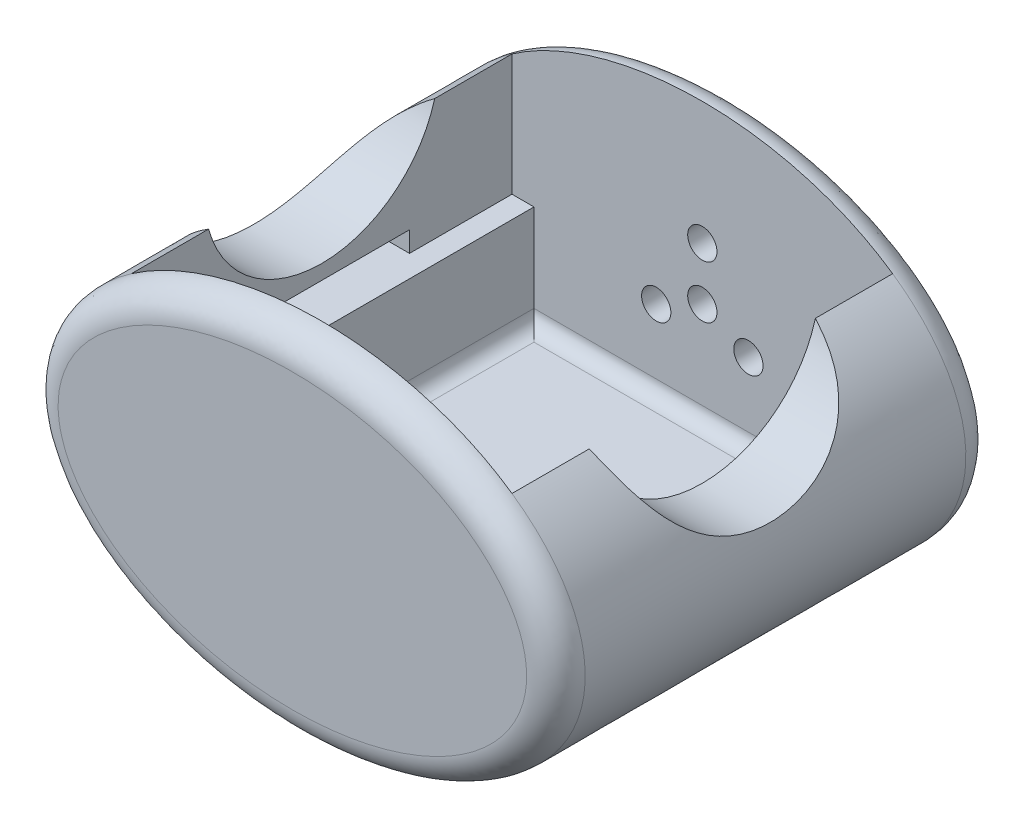
from build123d import *

# Parameters (mm, degrees)
SKETCH1_RX               = 22.86
SKETCH1_RY               = 15.24
BOSS_EXTRUDE4_DEPTH      = 45.72
CUT_EXTRUDE2_START       = -10.16
SKETCH4_W                = 29.21
SKETCH4_H                = 17.78
CUT_EXTRUDE2_DEPTH       = 33.02
CUT_EXTRUDE4_DEPTH       = 33.02
CUT_EXTRUDE4_DEPTH_BACK  = 33.02
SKETCH7_W                = 14.643913221
SKETCH7_H                = 35.56
SKETCH8_R                = 1.27
CUT_EXTRUDE5_DEPTH       = 2.54
FILLET1_R                = 2.54
FILLET2_R                = 2.54
FILLET3_R                = 1.27
CUT_EXTRUDE13_START      = -2.54
SKETCH13_W               = 5.08
SKETCH13_H               = 5.08
CUT_EXTRUDE13_DEPTH      = 49.021314431
CUT_EXTRUDE14_DEPTH      = 52.821602807
CUT_EXTRUDE14_DEPTH_BACK = 52.821602807
SKETCH14_R               = 0.5
CUT_EXTRUDE16_START      = -2.54
SKETCH12_W               = 33.02
SKETCH12_H               = 19.05
CUT_EXTRUDE16_DEPTH      = 33.02
SKETCH17_W               = 15.24
SKETCH17_H               = 1.778
CUT_EXTRUDE17_DEPTH      = 1.778
SKETCH18_W               = 15.24
SKETCH18_H               = 1.778
CUT_EXTRUDE18_DEPTH      = 1.778
CUT_EXTRUDE19_DEPTH      = 47.972834865
CUT_EXTRUDE19_DEPTH_BACK = 47.972834865
SKETCH19_R               = 10.16


with BuildPart() as part:
    # Sketch1 → Boss-Extrude4 (new body)
    with BuildSketch(Plane.XY):
        with Locations(Location((0, 0), (0, 0, 180))):
            Ellipse(SKETCH1_RX, SKETCH1_RY)
    extrude(amount=BOSS_EXTRUDE4_DEPTH)

    # Sketch4 → Cut-Extrude2 (cut)
    with BuildSketch(Plane.XY.offset(45.72).offset(CUT_EXTRUDE2_START)):
        Rectangle(SKETCH4_W, SKETCH4_H)
    extrude(amount=-CUT_EXTRUDE2_DEPTH, mode=Mode.SUBTRACT)

    # Sketch7 → Cut-Extrude4 (cut, two sides: drawn at the far end of the back side and taken through both)
    with BuildSketch(Plane(origin=(0, 0, 0), x_dir=(0, 0, -1), z_dir=(1, 0, 0)).offset(-CUT_EXTRUDE4_DEPTH_BACK)):
        with Locations((-45.421956611, -1.677648267)):
            Rectangle(SKETCH7_W, SKETCH7_H)
    extrude(amount=CUT_EXTRUDE4_DEPTH + CUT_EXTRUDE4_DEPTH_BACK, mode=Mode.SUBTRACT)

    # Sketch8 → Cut-Extrude5 (cut)
    with BuildSketch(Plane.XY):
        Circle(SKETCH8_R)
        with Locations((3.998447315, -1.999223657)):
            Circle(SKETCH8_R)
        with Locations((-3.998447315, -1.999223657)):
            Circle(SKETCH8_R)
        with Locations((0, 4.572)):
            Circle(SKETCH8_R)
    extrude(amount=CUT_EXTRUDE5_DEPTH, mode=Mode.SUBTRACT)

    # Fillet1
    fillet1_edges = [part.edges().sort_by_distance(p)[0] for p in [
        (22.859987041, 0.016227247, 0),
    ]]
    fillet(fillet1_edges, radius=FILLET1_R)

    # Fillet2
    fillet2_edges = [part.edges().sort_by_distance(p)[0] for p in [
        (22.860000074, 1.7e-08, 38.1),
    ]]
    fillet(fillet2_edges, radius=FILLET2_R)

    # Fillet3
    fillet3_edges = [part.edges().sort_by_distance(p)[0] for p in [
        (-14.605, -8.89, 19.05),
        (0, -8.89, 2.54),
        (14.605, -8.89, 19.05),
        (0, -8.89, 35.56),
    ]]
    fillet(fillet3_edges, radius=FILLET3_R)

    # Sketch13 → Cut-Extrude13 (cut, through all)
    with BuildSketch(Plane(origin=(0, -8.89, 0), x_dir=(1, 0, 0), z_dir=(0, 1, 0)).offset(CUT_EXTRUDE13_START)):
        with Locations((0, -18.288)):
            Rectangle(SKETCH13_W, SKETCH13_H)
    extrude(amount=-CUT_EXTRUDE13_DEPTH, mode=Mode.SUBTRACT)

    # Sketch14 → Cut-Extrude14 (cut, two sides: drawn at the far end of the back side and taken through both)
    with BuildSketch(Plane.XZ.offset(11.43).offset(-CUT_EXTRUDE14_DEPTH_BACK)):
        with Locations((0, 20.077999976)):
            Circle(SKETCH14_R)
        with Locations((0, 16.498)):
            Circle(SKETCH14_R)
    extrude(amount=CUT_EXTRUDE14_DEPTH + CUT_EXTRUDE14_DEPTH_BACK, mode=Mode.SUBTRACT)

    # Sketch12 → Cut-Extrude16 (cut)
    with BuildSketch(Plane(origin=(0, 0, 0), x_dir=(-1, 0, 0), z_dir=(0, 0, -1)).offset(CUT_EXTRUDE16_START)):
        with Locations((0, 9.525)):
            Rectangle(SKETCH12_W, SKETCH12_H)
    extrude(amount=-CUT_EXTRUDE16_DEPTH, mode=Mode.SUBTRACT)

    # Sketch17 → Cut-Extrude17 (cut)
    with BuildSketch(Plane.ZY.offset(-16.51)):
        with Locations((19.05, 0.889)):
            Rectangle(SKETCH17_W, SKETCH17_H)
    extrude(amount=-CUT_EXTRUDE17_DEPTH, mode=Mode.SUBTRACT)

    # Sketch18 → Cut-Extrude18 (cut)
    with BuildSketch(Plane(origin=(-16.51, 0, 0), x_dir=(0, 0, -1), z_dir=(1, 0, 0))):
        with Locations((-19.05, 0.889)):
            Rectangle(SKETCH18_W, SKETCH18_H)
    extrude(amount=-CUT_EXTRUDE18_DEPTH, mode=Mode.SUBTRACT)

    # Sketch19 → Cut-Extrude19 (cut, two sides: drawn at the far end of the back side and taken through both)
    with BuildSketch(Plane(origin=(0, 0, 0), x_dir=(0, 0, -1), z_dir=(1, 0, 0)).offset(-CUT_EXTRUDE19_DEPTH_BACK)):
        with Locations((-19.05, 13.208)):
            Circle(SKETCH19_R)
    extrude(amount=CUT_EXTRUDE19_DEPTH + CUT_EXTRUDE19_DEPTH_BACK, mode=Mode.SUBTRACT)


solid = part.part
